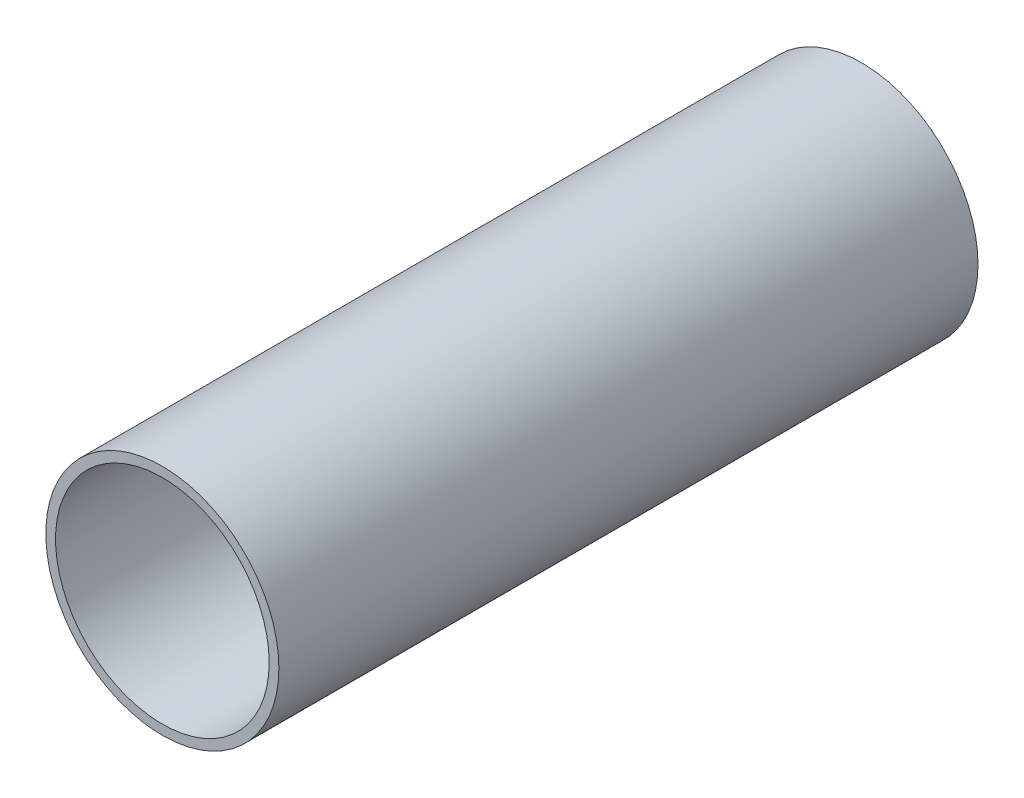
from build123d import *

# Parameters (mm, degrees)
SKETCH1_R           = 76.2
SKETCH1_R_2         = 69.85
BOSS_EXTRUDE1_DEPTH = 444.5
BOSS_EXTRUDE2_START = -12.7
SKETCH1_3_R         = 76.2
SKETCH1_3_R_2       = 63.5
BOSS_EXTRUDE2_DEPTH = 12.7


with BuildPart() as part:
    # Sketch1 → Boss-Extrude1 (new body)
    with BuildSketch(Plane.XY):
        Circle(SKETCH1_R)
        Circle(SKETCH1_R_2, mode=Mode.SUBTRACT)
    extrude(amount=BOSS_EXTRUDE1_DEPTH)

    # Sketch1<3> → Boss-Extrude2 (add)
    with BuildSketch(Plane.XY.offset(BOSS_EXTRUDE2_START)):
        Circle(SKETCH1_3_R)
        Circle(SKETCH1_3_R_2, mode=Mode.SUBTRACT)
    extrude(amount=BOSS_EXTRUDE2_DEPTH)


solid = part.part
